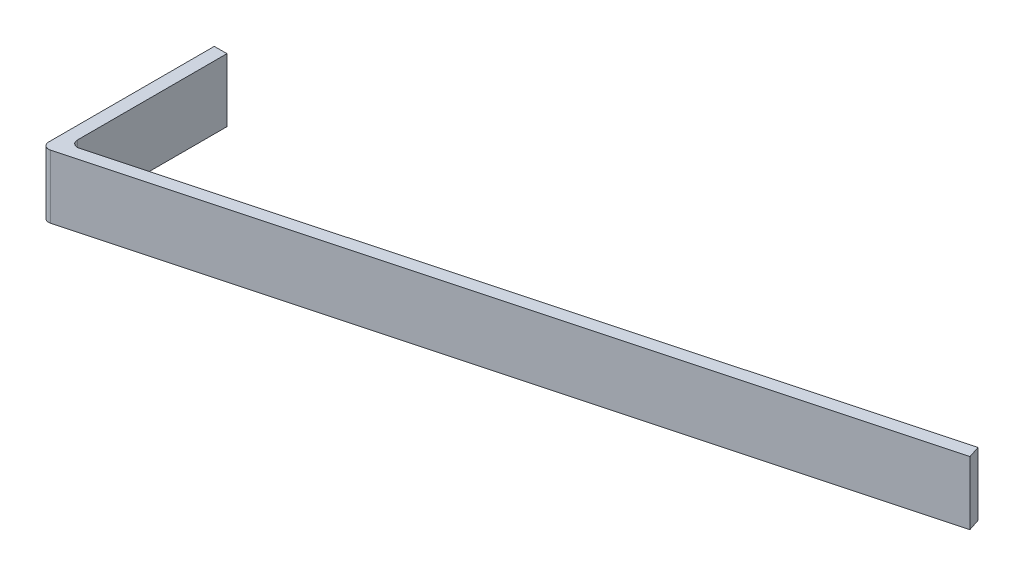
from build123d import *

# Parameters (mm, degrees)
BOSS_EXTRUDE1_DEPTH = 10
BOSS_EXTRUDE2_DEPTH = 10
FILLET1_R           = 1


with BuildPart() as part:
    # Sketch1 → Boss-Extrude1 (new body)
    with BuildSketch(Plane(origin=(0, 0, 0), x_dir=(1, 0, 0), z_dir=(0, 1, 0))):
        Polygon((0, 0), (2, 0.535898385), (2, 27.5), (0, 27.5), align=None)
    extrude(amount=BOSS_EXTRUDE1_DEPTH)

    # Sketch3 → Boss-Extrude2 (add)
    with BuildSketch(Plane.XZ):
        Polygon((0, 0), (115.911099155, -31.058285412), (115.285791267, -32.958019616), (0, -2), align=None)
    extrude(amount=-BOSS_EXTRUDE2_DEPTH)

    # Fillet1
    fillet1_edges = [part.edges().sort_by_distance(p)[0] for p in [
        (0, 5, 0),
        (2, 5, -2.537065657),
    ]]
    fillet(fillet1_edges, radius=FILLET1_R)


solid = part.part
